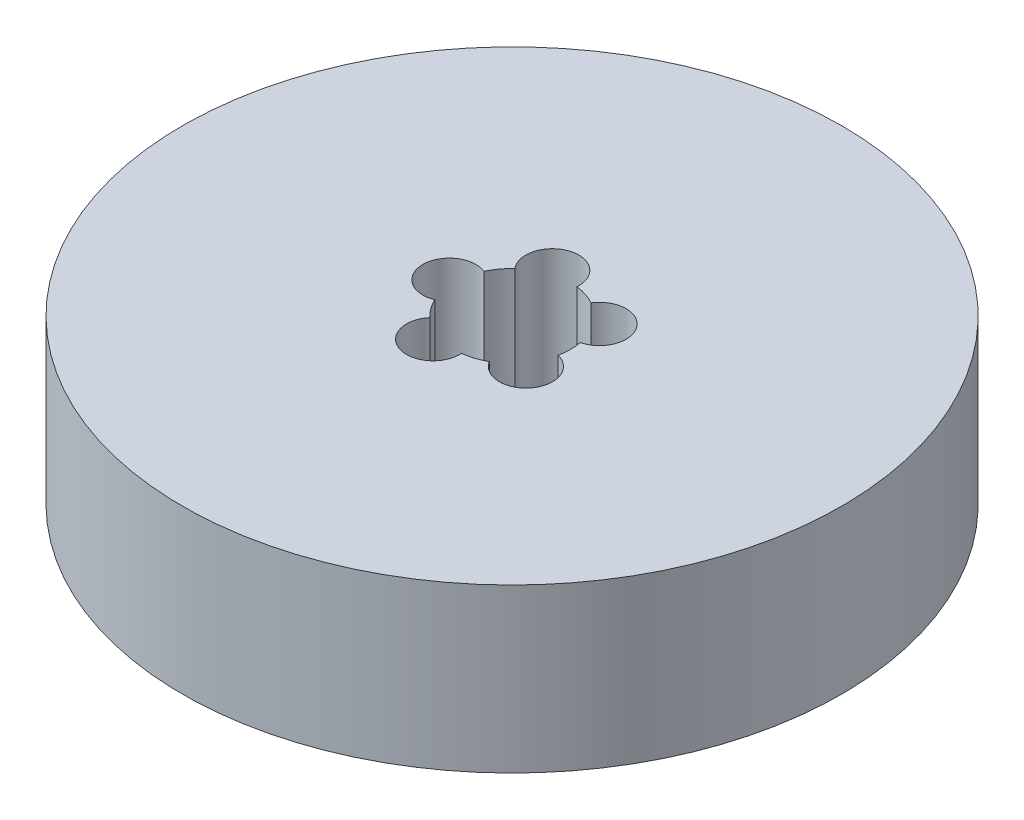
from build123d import *

# Parameters (mm, degrees)
SKETCH1_R           = 42.5
BOSS_EXTRUDE1_DEPTH = 21
SKETCH2_R           = 7.5
CUT_EXTRUDE1_DEPTH  = 64.667102965
SKETCH3_R           = 3.424286573
CUT_EXTRUDE2_DEPTH  = 19.51094656
CIRPATTERN1_COUNT   = 5


with BuildPart() as part:
    # Sketch1 → Boss-Extrude1 (new body)
    with BuildSketch(Plane(origin=(0, 0, 0), x_dir=(1, 0, 0), z_dir=(0, 1, 0))):
        Circle(SKETCH1_R)
    extrude(amount=BOSS_EXTRUDE1_DEPTH)

    # Sketch2 → Cut-Extrude1 (cut, through all)
    with BuildSketch(Plane(origin=(0, 0, 0), x_dir=(1, 0, 0), z_dir=(0, 1, 0))):
        Circle(SKETCH2_R)
    extrude(amount=CUT_EXTRUDE1_DEPTH, mode=Mode.SUBTRACT)

    # Sketch3 → Cut-Extrude2 (cut)
    with BuildSketch(Plane(origin=(0, 21, 0), x_dir=(1, 0, 0), z_dir=(0, 1, 0))):
        with Locations((-8.080758313, 0)):
            Circle(SKETCH3_R)
    cut_extrude2 = extrude(amount=-CUT_EXTRUDE2_DEPTH, mode=Mode.SUBTRACT)

    # CirPattern1: Cut-Extrude2 ×5 about axis
    cirpattern1_axis = Axis((0, 0, 0), (0, 1, 0))
    for i in range(1, CIRPATTERN1_COUNT):
        add(cut_extrude2.rotate(cirpattern1_axis, i * 360 / CIRPATTERN1_COUNT), mode=Mode.SUBTRACT)


solid = part.part
